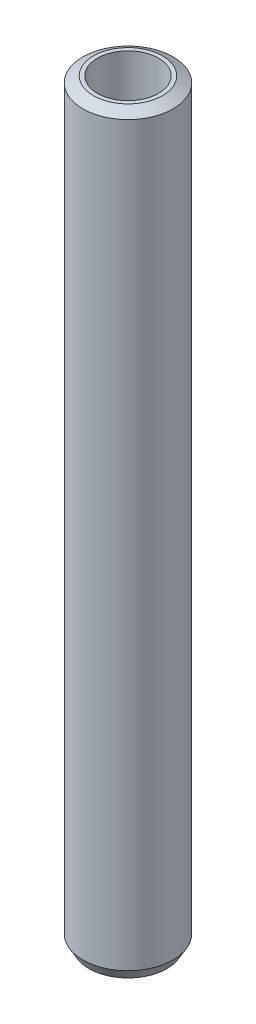
from build123d import *
from OCP.BRepFilletAPI import BRepFilletAPI_MakeChamfer

# Parameters (mm, degrees)
SKETCH1_R           = 20
BOSS_EXTRUDE1_DEPTH = 334.302653047
SKETCH2_R           = 13.554409648
CUT_EXTRUDE1_DEPTH  = 336.497039979
CHAMFER1_SIZE       = 2.709708183
CHAMFER1_SIZE2      = 4.693352247


with BuildPart() as part:
    # Sketch1 → Boss-Extrude1 (new body)
    with BuildSketch(Plane(origin=(0, 0, 0), x_dir=(1, 0, 0), z_dir=(0, 1, 0))):
        Circle(SKETCH1_R)
    extrude(amount=BOSS_EXTRUDE1_DEPTH)

    # Sketch2 → Cut-Extrude1 (cut, through all)
    with BuildSketch(Plane(origin=(0, 0, 0), x_dir=(1, 0, 0), z_dir=(0, 1, 0))):
        Circle(SKETCH2_R)
    extrude(amount=CUT_EXTRUDE1_DEPTH, mode=Mode.SUBTRACT)

    # Chamfer1: one chamfer whose edges measure the first distance from different faces: ONE call of the kernel's chamfer builder (chamfer() names one face for all edges)
    chamfer1_edges_1 = [part.edges().sort_by_distance(p)[0] for p in [
        (-20, 334.302653047, 0),
    ]]
    chamfer1_side_1 = [part.faces().sort_by_distance(p)[0] for p in [
        (-20, 167.151326524, 0),
    ]]
    chamfer1_edges_2 = [part.edges().sort_by_distance(p)[0] for p in [
        (-20, 0, 0),
    ]]
    chamfer1_side_2 = [part.faces().sort_by_distance(p)[0] for p in [
        (-19.434314575, 0, 0),
    ]]
    chamfer1 = BRepFilletAPI_MakeChamfer(part.part.solid().wrapped)
    for e in chamfer1_edges_1:
        chamfer1.Add(CHAMFER1_SIZE, CHAMFER1_SIZE2, e.wrapped, chamfer1_side_1[0].wrapped)  # the first distance lies on this face
    for e in chamfer1_edges_2:
        chamfer1.Add(CHAMFER1_SIZE, CHAMFER1_SIZE2, e.wrapped, chamfer1_side_2[0].wrapped)  # the first distance lies on this face
    add(Compound.cast(chamfer1.Shape()), mode=Mode.REPLACE)


solid = part.part
